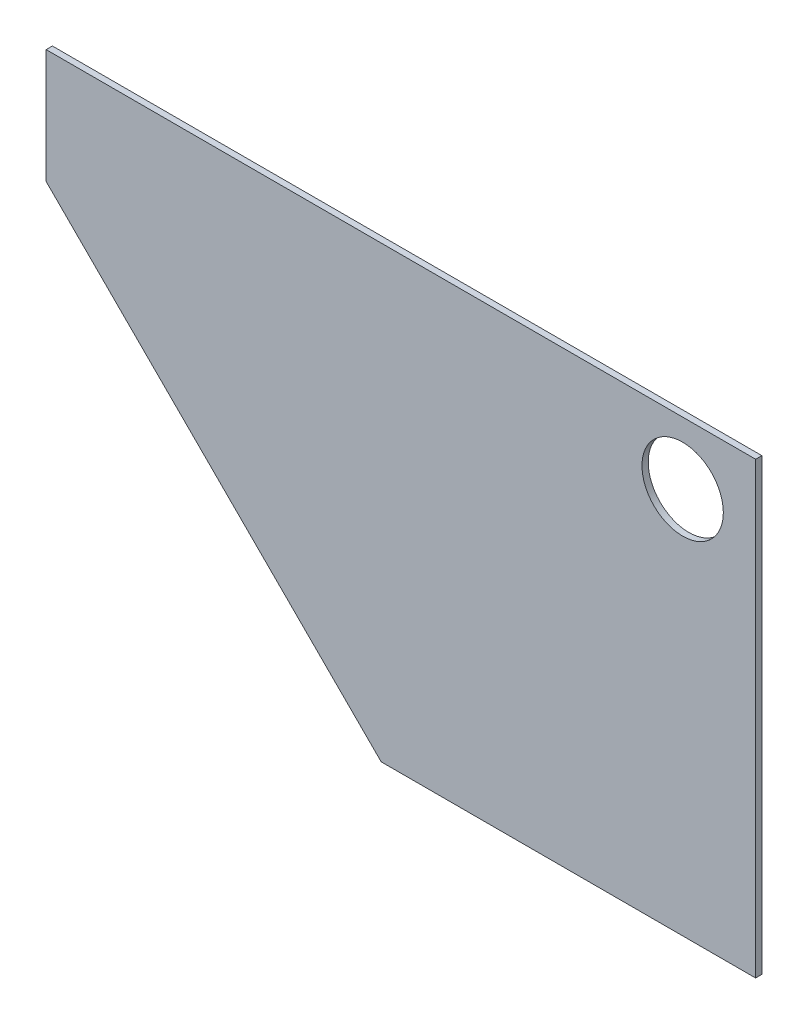
from build123d import *

# Parameters (mm, degrees)
SKETCH1_R           = 20.701
BOSS_EXTRUDE1_DEPTH = 3.175


with BuildPart() as part:
    # Sketch1 → Boss-Extrude1 (new body)
    with BuildSketch(Plane.XY):
        Polygon((-138.259383474, 48.991487021), (32.210627804, -121.478524257), (222.710627804, -121.478524257), (222.710627804, 107.121475743), (-138.259383474, 107.121475743), align=None)
        with Locations((185.590616526, 75.371475743)):
            Circle(SKETCH1_R, mode=Mode.SUBTRACT)
    extrude(amount=BOSS_EXTRUDE1_DEPTH)


solid = part.part
